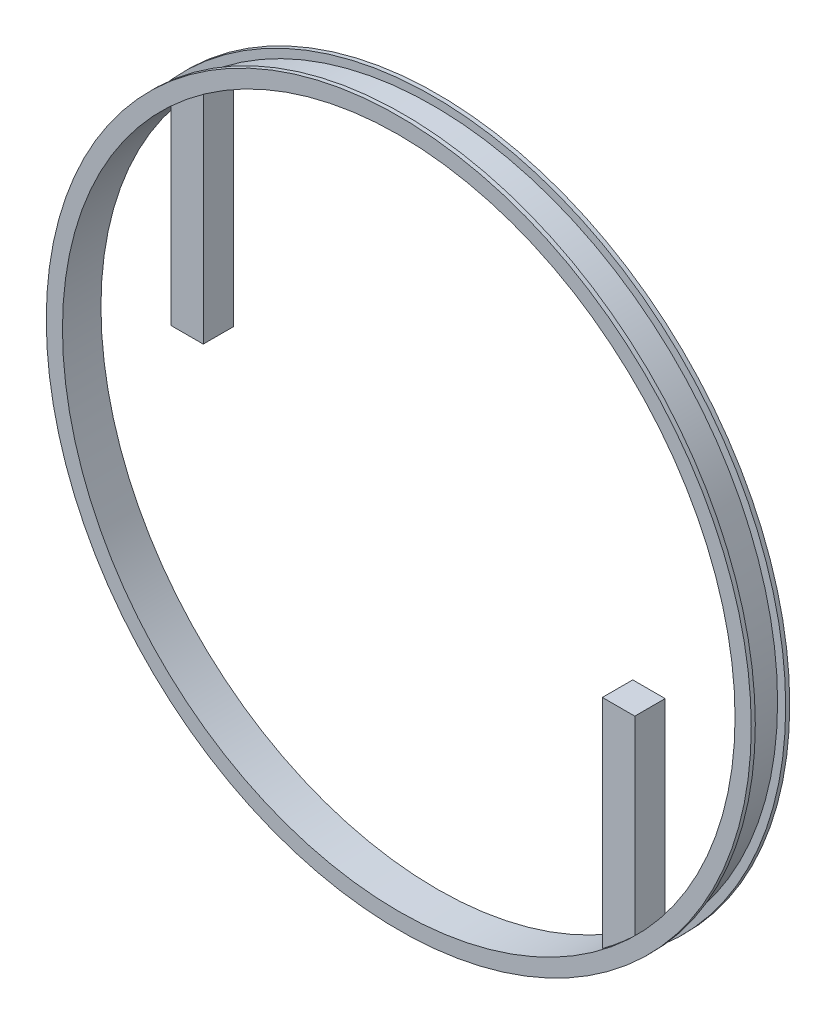
from build123d import *

# Parameters (mm, degrees)
TRACK_START     = -3.75
TRACK_OUTLINE_R = 85
TRACK_DEPTH     = 7.5
SKETCH2_R       = 87
SKETCH2_R_2     = 83
RAIL_DEPTH      = 1


# Read off the part's stored shape, not the designer's step: Track
with BuildPart() as part:
    # Track outline → Track (new body)
    with BuildSketch(Plane.XY.offset(TRACK_START)):
        Circle(TRACK_OUTLINE_R)
        with BuildLine():
            Line((57.25, -60.095236916), (57.25, -13.13))
            Line((57.25, -13.13), (49.25, -13.13))
            Line((49.25, -13.13), (49.25, -66.808962722))
            ThreePointArc((49.25, -66.808962722), (-63.578054165, -53.355702868), (-57.25, 60.095236916))
            Line((-57.25, 60.095236916), (-57.25, 13.13))
            Line((-57.25, 13.13), (-49.25, 13.13))
            Line((-49.25, 13.13), (-49.25, 66.808962722))
            ThreePointArc((-49.25, 66.808962722), (63.578054165, 53.355702868), (57.25, -60.095236916))
        make_face(mode=Mode.SUBTRACT)
    extrude(amount=TRACK_DEPTH)

    # Sketch2 → Rail (add)
    with BuildSketch(Plane.XY.offset(3.75)):
        Circle(SKETCH2_R)
        with Locations(Location((0, 0, 0), (0, 0, 133.611037517))):
            Circle(SKETCH2_R_2, mode=Mode.SUBTRACT)
    rail = extrude(amount=RAIL_DEPTH)

    # Mirror1: Rail across plane
    add(rail.mirror(Plane.XY))


solid = part.part
